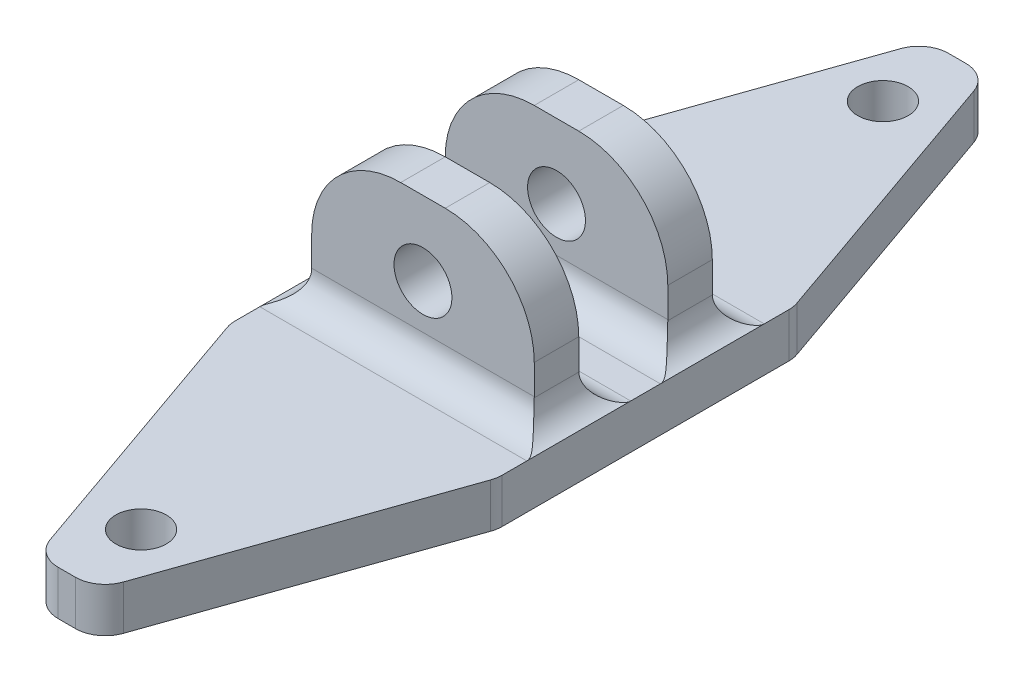
from build123d import *

# Parameters (mm, degrees)
EXTRUDE_1_DEPTH      = 3
SKETCH_2_W           = 15
SKETCH_2_H           = 3
EXTRUDE_2_DEPTH      = 10
FILLET_1_R           = 6
FILLET_2_R           = 2
HOLE_WIZARD_M3_1_D   = 3.4
HOLE_WIZARD_M3_5_1_D = 3.9


with BuildPart() as part:
    # 草图1 → 凸台-拉伸1 (new body)
    with BuildSketch(Plane(origin=(0, 0, 0), x_dir=(1, 0, 0), z_dir=(0, 1, 0))):
        Polygon((9, 10), (2, 30), (-2, 30), (-9, 10), (-9, -10), (-2, -30), (2, -30), (9, -10), align=None)
    extrude(amount=-EXTRUDE_1_DEPTH)

    # 草图2 → 凸台-拉伸2 (add)
    with BuildSketch(Plane(origin=(0, 0, 0), x_dir=(1, 0, 0), z_dir=(0, 1, 0))):
        with Locations((0, 4.5)):
            Rectangle(SKETCH_2_W, SKETCH_2_H)
        with Locations((0, -4.5)):
            Rectangle(SKETCH_2_W, SKETCH_2_H)
    extrude(amount=EXTRUDE_2_DEPTH)

    # 圆角1
    fillet_1_edges = [part.edges().sort_by_distance(p)[0] for p in [
        (-7.5, 10, -4.5),
        (7.5, 10, -4.5),
        (-7.5, 10, 4.5),
        (7.5, 10, 4.5),
    ]]
    fillet(fillet_1_edges, radius=FILLET_1_R)

    # 圆角2
    # the kernel refuses this fillet: 2 mm, written as the material it adds along each edge
    with BuildSketch(Plane(origin=(-7.5, 0, -3), x_dir=(-1, 0, 0), z_dir=(0, 0, -1)), Plane(origin=(7.5, 0, -6), x_dir=(1, 0, 0), z_dir=(0, 0, 1)), Plane(origin=(7.5, 0, 3), x_dir=(1, 0, 0), z_dir=(0, 0, 1))) as fillet_2_piece_1:
        with BuildLine():
            CenterArc((2, 1.936491673), FILLET_2_R, 180, 75.522487814)
            Line((0, 1.936491673), (0, 0))
            Line((0, 0), (1.5, 0))
        make_face()
    extrude(amount=3)
    with BuildSketch(Plane(origin=(7.5, 0, -3), x_dir=(0, 0, 1), z_dir=(-1, 0, 0)), Plane(origin=(-7.5, 0, -6), x_dir=(0, 0, -1), z_dir=(1, 0, 0)), Plane(origin=(-7.5, 0, 3), x_dir=(0, 0, -1), z_dir=(1, 0, 0))) as fillet_2_piece_2:
        with BuildLine():
            CenterArc((FILLET_2_R, FILLET_2_R), FILLET_2_R, 180, 90)
            Line((0, FILLET_2_R), (0, 0))
            Line((0, 0), (FILLET_2_R, 0))
        make_face()
    extrude(amount=15)
    with BuildSketch(Plane(origin=(-7.5, 0, 6), x_dir=(0, 1, 0), z_dir=(0, 0, -1))) as fillet_2_piece_3:
        with BuildLine():
            CenterArc((1.936491673, -2), FILLET_2_R, 90, 75.522487814)
            Line((0, -1.5), (0, 0))
            Line((0, 0), (1.936491673, 0))
        make_face()
    extrude(amount=3)
    with BuildSketch(Plane(origin=(7.5, 0, 6), x_dir=(0, 1, 0), z_dir=(-1, 0, 0))) as fillet_2_piece_4:
        with BuildLine():
            CenterArc((FILLET_2_R, -FILLET_2_R), FILLET_2_R, 90, 90)
            Line((0, -FILLET_2_R), (0, 0))
            Line((0, 0), (FILLET_2_R, 0))
        make_face()
    extrude(amount=15)
    with BuildSketch(Plane(origin=(-7.5, 0, 1.841229183), x_dir=(-1, 0, 0), z_dir=(0, 0, -1))) as fillet_2_piece_5a_section:
        with BuildLine():
            CenterArc((2, 1.936491673), FILLET_2_R, 180, 75.522487814)
            Line((0, 1.936491673), (0, 0))
            Line((0, 0), (1.5, 0))
        make_face()
    fillet_2_piece_5a = extrude(amount=7.841229183, mode=Mode.PRIVATE)
    fillet_2_piece_5a = split(fillet_2_piece_5a, bisect_by=Plane(origin=(-7.5, 0, -3), z_dir=(0, 0, 1)), keep=Keep.TOP, mode=Mode.PRIVATE)
    with BuildSketch(Plane(origin=(7.5, 0, -3), x_dir=(0, 0, 1), z_dir=(-1, 0, 0))) as fillet_2_piece_5b_section:
        with BuildLine():
            CenterArc((FILLET_2_R, FILLET_2_R), FILLET_2_R, 180, 90)
            Line((0, FILLET_2_R), (0, 0))
            Line((0, 0), (FILLET_2_R, 0))
        make_face()
    fillet_2_piece_5b = extrude(amount=20, mode=Mode.PRIVATE)
    fillet_2_piece_5b = split(fillet_2_piece_5b, bisect_by=Plane(origin=(-9, 0, -3), z_dir=(1, 0, 0)), keep=Keep.TOP, mode=Mode.PRIVATE)
    fillet_2_piece_5b = split(fillet_2_piece_5b, bisect_by=Plane(origin=(-7.5, 0, -3), z_dir=(-1, 0, 0)), keep=Keep.TOP, mode=Mode.PRIVATE)
    fillet_2_piece_5 = fillet_2_piece_5a & fillet_2_piece_5b
    add(fillet_2_piece_5)
    with BuildSketch(Plane(origin=(-7.5, 0, -3), x_dir=(-1, 0, 0), z_dir=(0, 0, -1))) as fillet_2_piece_6a_section:
        with BuildLine():
            CenterArc((2, 1.936491673), FILLET_2_R, 180, 75.522487814)
            Line((0, 1.936491673), (0, 0))
            Line((0, 0), (1.5, 0))
        make_face()
    fillet_2_piece_6a = extrude(amount=7.841229183, mode=Mode.PRIVATE)
    fillet_2_piece_6a = split(fillet_2_piece_6a, bisect_by=Plane(origin=(-11.018930958, 0, -4.231625835), z_dir=(0.9438583563660174, 0, 0.3303504247281063)), keep=Keep.TOP, mode=Mode.PRIVATE)
    fillet_2_piece_6a = split(fillet_2_piece_6a, bisect_by=Plane(origin=(-7.5, 0, -6), z_dir=(0, 0, -1)), keep=Keep.TOP, mode=Mode.PRIVATE)
    with BuildSketch(Plane(origin=(-12.5, 0, -6), x_dir=(0, 0, -1), z_dir=(1, 0, 0))) as fillet_2_piece_6b_section:
        with BuildLine():
            CenterArc((FILLET_2_R, FILLET_2_R), FILLET_2_R, 180, 90)
            Line((0, FILLET_2_R), (0, 0))
            Line((0, 0), (FILLET_2_R, 0))
        make_face()
    fillet_2_piece_6b = extrude(amount=20, mode=Mode.PRIVATE)
    fillet_2_piece_6b = split(fillet_2_piece_6b, bisect_by=Plane(origin=(-9, 0, -6), z_dir=(1, 0, 0)), keep=Keep.TOP, mode=Mode.PRIVATE)
    fillet_2_piece_6b = split(fillet_2_piece_6b, bisect_by=Plane(origin=(-7.5, 0, -6), z_dir=(-1, 0, 0)), keep=Keep.TOP, mode=Mode.PRIVATE)
    fillet_2_piece_6 = fillet_2_piece_6a & fillet_2_piece_6b
    add(fillet_2_piece_6)
    with BuildSketch(Plane(origin=(12.5, 0, -3), x_dir=(0, 0, 1), z_dir=(-1, 0, 0))) as fillet_2_piece_7a_section:
        with BuildLine():
            CenterArc((FILLET_2_R, FILLET_2_R), FILLET_2_R, 180, 90)
            Line((0, FILLET_2_R), (0, 0))
            Line((0, 0), (FILLET_2_R, 0))
        make_face()
    fillet_2_piece_7a = extrude(amount=20, mode=Mode.PRIVATE)
    fillet_2_piece_7a = split(fillet_2_piece_7a, bisect_by=Plane(origin=(9, 0, -3), z_dir=(-1, 0, 0)), keep=Keep.TOP, mode=Mode.PRIVATE)
    fillet_2_piece_7a = split(fillet_2_piece_7a, bisect_by=Plane(origin=(7.5, 0, -3), z_dir=(1, 0, 0)), keep=Keep.TOP, mode=Mode.PRIVATE)
    with BuildSketch(Plane(origin=(7.5, 0, -6), x_dir=(1, 0, 0), z_dir=(0, 0, 1))) as fillet_2_piece_7b_section:
        with BuildLine():
            CenterArc((2, 1.936491673), FILLET_2_R, 180, 75.522487814)
            Line((0, 1.936491673), (0, 0))
            Line((0, 0), (1.5, 0))
        make_face()
    fillet_2_piece_7b = extrude(amount=7.841229183, mode=Mode.PRIVATE)
    fillet_2_piece_7b = split(fillet_2_piece_7b, bisect_by=Plane(origin=(7.5, 0, -3), z_dir=(0, 0, 1)), keep=Keep.TOP, mode=Mode.PRIVATE)
    fillet_2_piece_7 = fillet_2_piece_7a & fillet_2_piece_7b
    add(fillet_2_piece_7)
    with BuildSketch(Plane(origin=(7.5, 0, -10.841229183), x_dir=(1, 0, 0), z_dir=(0, 0, 1))) as fillet_2_piece_8a_section:
        with BuildLine():
            CenterArc((2, 1.936491673), FILLET_2_R, 180, 75.522487814)
            Line((0, 1.936491673), (0, 0))
            Line((0, 0), (1.5, 0))
        make_face()
    fillet_2_piece_8a = extrude(amount=7.841229183, mode=Mode.PRIVATE)
    fillet_2_piece_8a = split(fillet_2_piece_8a, bisect_by=Plane(origin=(8.574004264, 0, -11.217130675), z_dir=(-0.9438583563660174, 0, 0.3303504247281061)), keep=Keep.TOP, mode=Mode.PRIVATE)
    fillet_2_piece_8a = split(fillet_2_piece_8a, bisect_by=Plane(origin=(7.5, 0, -6), z_dir=(0, 0, -1)), keep=Keep.TOP, mode=Mode.PRIVATE)
    with BuildSketch(Plane(origin=(-7.5, 0, -6), x_dir=(0, 0, -1), z_dir=(1, 0, 0))) as fillet_2_piece_8b_section:
        with BuildLine():
            CenterArc((FILLET_2_R, FILLET_2_R), FILLET_2_R, 180, 90)
            Line((0, FILLET_2_R), (0, 0))
            Line((0, 0), (FILLET_2_R, 0))
        make_face()
    fillet_2_piece_8b = extrude(amount=20, mode=Mode.PRIVATE)
    fillet_2_piece_8b = split(fillet_2_piece_8b, bisect_by=Plane(origin=(9, 0, -6), z_dir=(-1, 0, 0)), keep=Keep.TOP, mode=Mode.PRIVATE)
    fillet_2_piece_8b = split(fillet_2_piece_8b, bisect_by=Plane(origin=(7.5, 0, -6), z_dir=(1, 0, 0)), keep=Keep.TOP, mode=Mode.PRIVATE)
    fillet_2_piece_8 = fillet_2_piece_8a & fillet_2_piece_8b
    add(fillet_2_piece_8)
    with BuildSketch(Plane(origin=(-7.5, 0, 10.841229183), x_dir=(0, 1, 0), z_dir=(0, 0, -1))) as fillet_2_piece_9a_section:
        with BuildLine():
            CenterArc((1.936491673, -2), FILLET_2_R, 90, 75.522487814)
            Line((0, -1.5), (0, 0))
            Line((0, 0), (1.936491673, 0))
        make_face()
    fillet_2_piece_9a = extrude(amount=7.841229183, mode=Mode.PRIVATE)
    fillet_2_piece_9a = split(fillet_2_piece_9a, bisect_by=Plane(origin=(-7.5, 0, 6), z_dir=(0, 0, 1)), keep=Keep.TOP, mode=Mode.PRIVATE)
    fillet_2_piece_9a = split(fillet_2_piece_9a, bisect_by=Plane(origin=(-8.574004264, 0, 11.217130675), z_dir=(0.9438583563660174, 0, -0.33035042472810616)), keep=Keep.TOP, mode=Mode.PRIVATE)
    with BuildSketch(Plane(origin=(7.5, 0, 6), x_dir=(0, 1, 0), z_dir=(-1, 0, 0))) as fillet_2_piece_9b_section:
        with BuildLine():
            CenterArc((FILLET_2_R, -FILLET_2_R), FILLET_2_R, 90, 90)
            Line((0, -FILLET_2_R), (0, 0))
            Line((0, 0), (FILLET_2_R, 0))
        make_face()
    fillet_2_piece_9b = extrude(amount=20, mode=Mode.PRIVATE)
    fillet_2_piece_9b = split(fillet_2_piece_9b, bisect_by=Plane(origin=(-7.5, 0, 6), z_dir=(-1, 0, 0)), keep=Keep.TOP, mode=Mode.PRIVATE)
    fillet_2_piece_9b = split(fillet_2_piece_9b, bisect_by=Plane(origin=(-9, 0, 6), z_dir=(1, 0, 0)), keep=Keep.TOP, mode=Mode.PRIVATE)
    fillet_2_piece_9 = fillet_2_piece_9a & fillet_2_piece_9b
    add(fillet_2_piece_9)
    with BuildSketch(Plane(origin=(-7.5, 0, 6), x_dir=(0, 1, 0), z_dir=(0, 0, -1))) as fillet_2_piece_10a_section:
        with BuildLine():
            CenterArc((1.936491673, -2), FILLET_2_R, 90, 75.522487814)
            Line((0, -1.5), (0, 0))
            Line((0, 0), (1.936491673, 0))
        make_face()
    fillet_2_piece_10a = extrude(amount=7.841229183, mode=Mode.PRIVATE)
    fillet_2_piece_10a = split(fillet_2_piece_10a, bisect_by=Plane(origin=(-7.5, 0, 3), z_dir=(0, 0, -1)), keep=Keep.TOP, mode=Mode.PRIVATE)
    with BuildSketch(Plane(origin=(-12.5, 0, 3), x_dir=(0, 0, -1), z_dir=(1, 0, 0))) as fillet_2_piece_10b_section:
        with BuildLine():
            CenterArc((FILLET_2_R, FILLET_2_R), FILLET_2_R, 180, 90)
            Line((0, FILLET_2_R), (0, 0))
            Line((0, 0), (FILLET_2_R, 0))
        make_face()
    fillet_2_piece_10b = extrude(amount=20, mode=Mode.PRIVATE)
    fillet_2_piece_10b = split(fillet_2_piece_10b, bisect_by=Plane(origin=(-7.5, 0, 3), z_dir=(-1, 0, 0)), keep=Keep.TOP, mode=Mode.PRIVATE)
    fillet_2_piece_10b = split(fillet_2_piece_10b, bisect_by=Plane(origin=(-9, 0, 3), z_dir=(1, 0, 0)), keep=Keep.TOP, mode=Mode.PRIVATE)
    fillet_2_piece_10 = fillet_2_piece_10a & fillet_2_piece_10b
    add(fillet_2_piece_10)
    with BuildSketch(Plane(origin=(12.5, 0, 6), x_dir=(0, 1, 0), z_dir=(-1, 0, 0))) as fillet_2_piece_11a_section:
        with BuildLine():
            CenterArc((FILLET_2_R, -FILLET_2_R), FILLET_2_R, 90, 90)
            Line((0, -FILLET_2_R), (0, 0))
            Line((0, 0), (FILLET_2_R, 0))
        make_face()
    fillet_2_piece_11a = extrude(amount=20, mode=Mode.PRIVATE)
    fillet_2_piece_11a = split(fillet_2_piece_11a, bisect_by=Plane(origin=(7.5, 0, 6), z_dir=(1, 0, 0)), keep=Keep.TOP, mode=Mode.PRIVATE)
    fillet_2_piece_11a = split(fillet_2_piece_11a, bisect_by=Plane(origin=(9, 0, 6), z_dir=(-1, 0, 0)), keep=Keep.TOP, mode=Mode.PRIVATE)
    with BuildSketch(Plane(origin=(7.5, 0, 3), x_dir=(1, 0, 0), z_dir=(0, 0, 1))) as fillet_2_piece_11b_section:
        with BuildLine():
            CenterArc((2, 1.936491673), FILLET_2_R, 180, 75.522487814)
            Line((0, 1.936491673), (0, 0))
            Line((0, 0), (1.5, 0))
        make_face()
    fillet_2_piece_11b = extrude(amount=7.841229183, mode=Mode.PRIVATE)
    fillet_2_piece_11b = split(fillet_2_piece_11b, bisect_by=Plane(origin=(7.5, 0, 6), z_dir=(0, 0, 1)), keep=Keep.TOP, mode=Mode.PRIVATE)
    fillet_2_piece_11b = split(fillet_2_piece_11b, bisect_by=Plane(origin=(11.018930958, 0, 4.231625835), z_dir=(-0.9438583563660174, 0, -0.33035042472810605)), keep=Keep.TOP, mode=Mode.PRIVATE)
    fillet_2_piece_11 = fillet_2_piece_11a & fillet_2_piece_11b
    add(fillet_2_piece_11)
    with BuildSketch(Plane(origin=(7.5, 0, -1.841229183), x_dir=(1, 0, 0), z_dir=(0, 0, 1))) as fillet_2_piece_12a_section:
        with BuildLine():
            CenterArc((2, 1.936491673), FILLET_2_R, 180, 75.522487814)
            Line((0, 1.936491673), (0, 0))
            Line((0, 0), (1.5, 0))
        make_face()
    fillet_2_piece_12a = extrude(amount=7.841229183, mode=Mode.PRIVATE)
    fillet_2_piece_12a = split(fillet_2_piece_12a, bisect_by=Plane(origin=(7.5, 0, 3), z_dir=(0, 0, -1)), keep=Keep.TOP, mode=Mode.PRIVATE)
    with BuildSketch(Plane(origin=(-7.5, 0, 3), x_dir=(0, 0, -1), z_dir=(1, 0, 0))) as fillet_2_piece_12b_section:
        with BuildLine():
            CenterArc((FILLET_2_R, FILLET_2_R), FILLET_2_R, 180, 90)
            Line((0, FILLET_2_R), (0, 0))
            Line((0, 0), (FILLET_2_R, 0))
        make_face()
    fillet_2_piece_12b = extrude(amount=20, mode=Mode.PRIVATE)
    fillet_2_piece_12b = split(fillet_2_piece_12b, bisect_by=Plane(origin=(7.5, 0, 3), z_dir=(1, 0, 0)), keep=Keep.TOP, mode=Mode.PRIVATE)
    fillet_2_piece_12b = split(fillet_2_piece_12b, bisect_by=Plane(origin=(9, 0, 3), z_dir=(-1, 0, 0)), keep=Keep.TOP, mode=Mode.PRIVATE)
    fillet_2_piece_12 = fillet_2_piece_12a & fillet_2_piece_12b
    add(fillet_2_piece_12)
    # the kernel refuses this fillet: 2 mm, written as the material it takes off along each edge
    with BuildSketch(Plane(origin=(-2, 3.547405025, -30), x_dir=(1, 0, 0), z_dir=(0, -1, 0))) as fillet_2_2_piece_1:
        with BuildLine():
            CenterArc((FILLET_2_R * 0.709481005021, FILLET_2_R), FILLET_2_R, 199.290046219, 70.709953781)
            Line((-FILLET_2_R * 0.234377351345, FILLET_2_R * 0.669649575272), (0, 0))
            Line((0, 0), (FILLET_2_R * 0.709481005021, 0))
        make_face()
    extrude(amount=10.09481005, mode=Mode.SUBTRACT)
    with BuildSketch(Plane(origin=(2, 3.547405025, -30), x_dir=(-1, 0, 0), z_dir=(0, -1, 0)), Plane(origin=(2, 3.547405025, 30), x_dir=(0.3303504247281063, 0, -0.9438583563660173), z_dir=(0, -1, 0)), Plane(origin=(-2, 3.547405025, 30), x_dir=(1, 0, 0), z_dir=(0, -1, 0))) as fillet_2_2_piece_2:
        with BuildLine():
            CenterArc((FILLET_2_R * 0.709481005021, -FILLET_2_R), FILLET_2_R, 90, 70.709953781)
            Line((-FILLET_2_R * 0.234377351345, -FILLET_2_R * 0.669649575272), (0, 0))
            Line((0, 0), (FILLET_2_R * 0.709481005021, 0))
        make_face()
    extrude(amount=10.09481005, mode=Mode.SUBTRACT)
    with BuildSketch(Plane(origin=(9, 0.849728643, -10), x_dir=(-0.330350424728111, 0, -0.9438583563660158), z_dir=(0, -1, 0)), Plane(origin=(9, 0.849728643, 10), x_dir=(0, 0, -1), z_dir=(0, -1, 0)), Plane(origin=(-9, 0.849728643, -10), x_dir=(0, 0, 1), z_dir=(0, -1, 0))) as fillet_2_2_piece_3:
        with BuildLine():
            CenterArc((FILLET_2_R * 0.169945728631, -FILLET_2_R), FILLET_2_R, 90, 19.290046219)
            Line((-FILLET_2_R * 0.160404696097, -FILLET_2_R * 0.056141643634), (0, 0))
            Line((0, 0), (FILLET_2_R * 0.169945728631, 0))
        make_face()
    extrude(amount=4.699457286, mode=Mode.SUBTRACT)
    with BuildSketch(Plane(origin=(-9, 0.849728643, 10), x_dir=(0, 0, -1), z_dir=(0, -1, 0))) as fillet_2_2_piece_4:
        with BuildLine():
            CenterArc((FILLET_2_R * 0.169945728631, FILLET_2_R), FILLET_2_R, 250.709953781, 19.290046219)
            Line((-FILLET_2_R * 0.160404696097, FILLET_2_R * 0.056141643634), (0, 0))
            Line((0, 0), (FILLET_2_R * 0.169945728631, 0))
        make_face()
    extrude(amount=4.699457286, mode=Mode.SUBTRACT)

    # M3 间隙孔1 (through all)
    with Locations(Plane(origin=(0, 0, 0), x_dir=(1, 0, 0), z_dir=(0, 1, 0))):
        with Locations((0, 25), (0, -25)):
            Hole(HOLE_WIZARD_M3_1_D / 2)

    # M3.5 间隙孔1 (through all)
    with Locations(Plane(origin=(0, 0, -6), x_dir=(-1, 0, 0), z_dir=(0, 0, -1))):
        with Locations((0, 5)):
            Hole(HOLE_WIZARD_M3_5_1_D / 2)


solid = part.part
